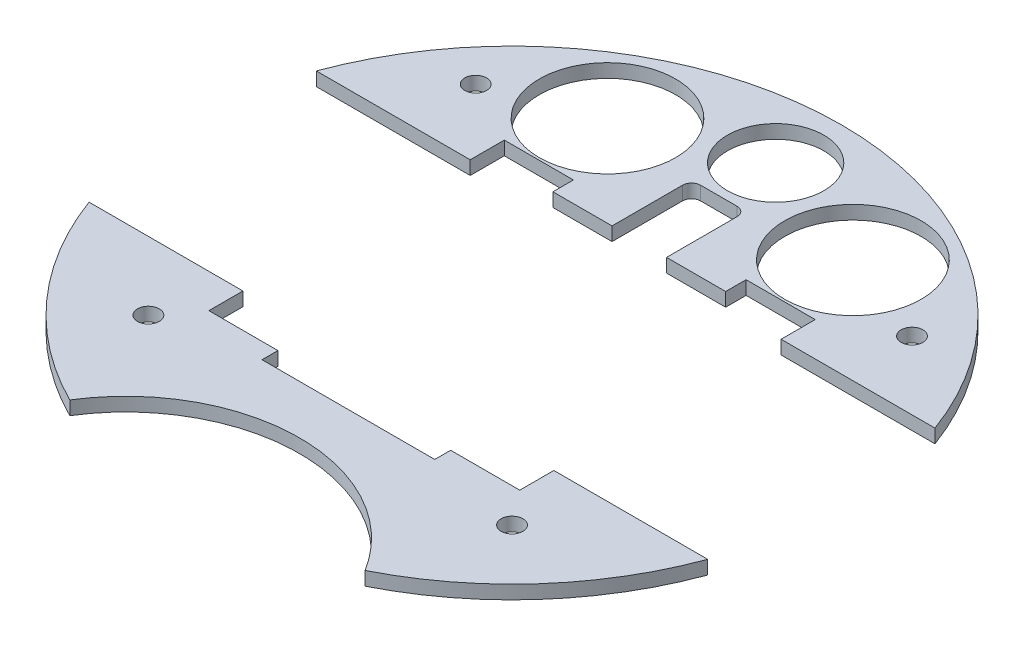
from build123d import *

# Parameters (mm, degrees)
BOSS_EXTRUDE1_DEPTH  = 3
SOLENOID_PLACEMENT_W = 38
SOLENOID_PLACEMENT_H = 64
CUT_EXTRUDE1_DEPTH   = 103.574363269
SKETCH7_R            = 15
CUT_EXTRUDE6_DEPTH   = 103.574363269
SKETCH8_R            = 2.4
CUT_EXTRUDE7_DEPTH   = 103.574363269
CUT_EXTRUDE3_DEPTH   = 103.574363269
CUT_EXTRUDE8_DEPTH   = 100.481153994
SKETCH10_R           = 10.605
CUT_EXTRUDE9_DEPTH   = 100.481153994


with BuildPart() as part:
    # Sketch1 → Boss-Extrude1 (new body)
    with BuildSketch(Plane(origin=(0, 0, 0), x_dir=(1, 0, 0), z_dir=(0, 1, 0))):
        with BuildLine():
            ThreePointArc((32.48910875, -64.812867647), (0, 72.5), (-32.48910875, -64.812867647))
            ThreePointArc((-32.48910875, -64.812867647), (0, -46.75), (32.48910875, -64.812867647))
        make_face()
    extrude(amount=BOSS_EXTRUDE1_DEPTH)

    # solenoid placement → Cut-Extrude1 (cut, through all)
    with BuildSketch(Plane(origin=(0, 3, 0), x_dir=(1, 0, 0), z_dir=(0, 1, 0))):
        with Locations((0, -4)):
            Rectangle(SOLENOID_PLACEMENT_W, SOLENOID_PLACEMENT_H)
    extrude(amount=-CUT_EXTRUDE1_DEPTH, mode=Mode.SUBTRACT)

    # Sketch7 → Cut-Extrude6 (cut, through all)
    with BuildSketch(Plane(origin=(0, 3, 0), x_dir=(1, 0, 0), z_dir=(0, 1, 0))):
        with Locations((27, 48)):
            Circle(SKETCH7_R)
        with Locations((-27, 48)):
            Circle(SKETCH7_R)
    extrude(amount=-CUT_EXTRUDE6_DEPTH, mode=Mode.SUBTRACT)

    # Sketch8 → Cut-Extrude7 (cut, through all)
    with BuildSketch(Plane(origin=(0, 3, 0), x_dir=(1, 0, 0), z_dir=(0, 1, 0))):
        with Locations((40, -40)):
            Circle(SKETCH8_R)
        with Locations((-40, -40)):
            Circle(SKETCH8_R)
        with Locations((48, 40)):
            Circle(SKETCH8_R)
        with Locations((-48, 40)):
            Circle(SKETCH8_R)
    extrude(amount=-CUT_EXTRUDE7_DEPTH, mode=Mode.SUBTRACT)

    # Sketch3 → Cut-Extrude3 (cut, through all)
    with BuildSketch(Plane(origin=(0, 3, 0), x_dir=(1, 0, 0), z_dir=(0, 1, 0))):
        with BuildLine():
            Line((-34.2, -32.5), (-22.2, -32.5))
            Line((-22.2, -32.5), (-19, -32.5))
            Line((-19, -32.5), (-19, 32.5))
            Line((-19, 32.5), (-22.2, 32.5))
            Line((-22.2, 32.5), (-34.2, 32.5))
            Line((-34.2, 32.5), (-34.2, 25))
            Line((-34.2, 25), (-68.053287944, 25))
            ThreePointArc((-68.053287944, 25), (-72.5, 0), (-68.053287944, -25))
            Line((-68.053287944, -25), (-34.2, -25))
            Line((-34.2, -25), (-34.2, -32.5))
        make_face()
        with BuildLine():
            Line((19, 32.5), (19, -32.5))
            Line((19, -32.5), (22.2, -32.5))
            Line((22.2, -32.5), (34.2, -32.5))
            Line((34.2, -32.5), (34.2, -25))
            Line((34.2, -25), (68.053287944, -25))
            ThreePointArc((68.053287944, -25), (72.5, 0), (68.053287944, 25))
            Line((68.053287944, 25), (34.2, 25))
            Line((34.2, 25), (34.2, 32.5))
            Line((34.2, 32.5), (22.2, 32.5))
            Line((22.2, 32.5), (19, 32.5))
        make_face()
    extrude(amount=-CUT_EXTRUDE3_DEPTH, mode=Mode.SUBTRACT)


with BuildPart() as cut_extrude3_piece_1:
    # of the separate pieces the step leaves, piece 1, a body of its own (cut_extrude3_pieces)
    add(part.part.solids().sort_by_distance((68.053287944, 0, -25))[0])

    # Sketch9 → Cut-Extrude8 (cut, through all)
    with BuildSketch(Plane(origin=(0, 3, 0), x_dir=(1, 0, 0), z_dir=(0, 1, 0))):
        with BuildLine():
            Line((6, 43.5), (6, 28))
            Line((6, 28), (-6, 28))
            Line((-6, 28), (-6, 43.5))
            ThreePointArc((-6, 43.5), (-5.414213562, 44.914213562), (-4, 45.5))
            Line((-4, 45.5), (4, 45.5))
            ThreePointArc((4, 45.5), (5.414213562, 44.914213562), (6, 43.5))
        make_face()
    extrude(amount=-CUT_EXTRUDE8_DEPTH, mode=Mode.SUBTRACT)

    # Sketch10 → Cut-Extrude9 (cut, through all)
    with BuildSketch(Plane(origin=(0, 3, 0), x_dir=(1, 0, 0), z_dir=(0, 1, 0))):
        with Locations((0, 58)):
            Circle(SKETCH10_R)
    extrude(amount=-CUT_EXTRUDE9_DEPTH, mode=Mode.SUBTRACT)


with BuildPart() as cut_extrude3_piece_2:
    # of the separate pieces the step leaves, piece 2, a body of its own (cut_extrude3_pieces)
    add(part.part.solids().sort_by_distance((32.48910875, 0, 64.812867647))[0])


solid = Compound([cut_extrude3_piece_1.part, cut_extrude3_piece_2.part])
